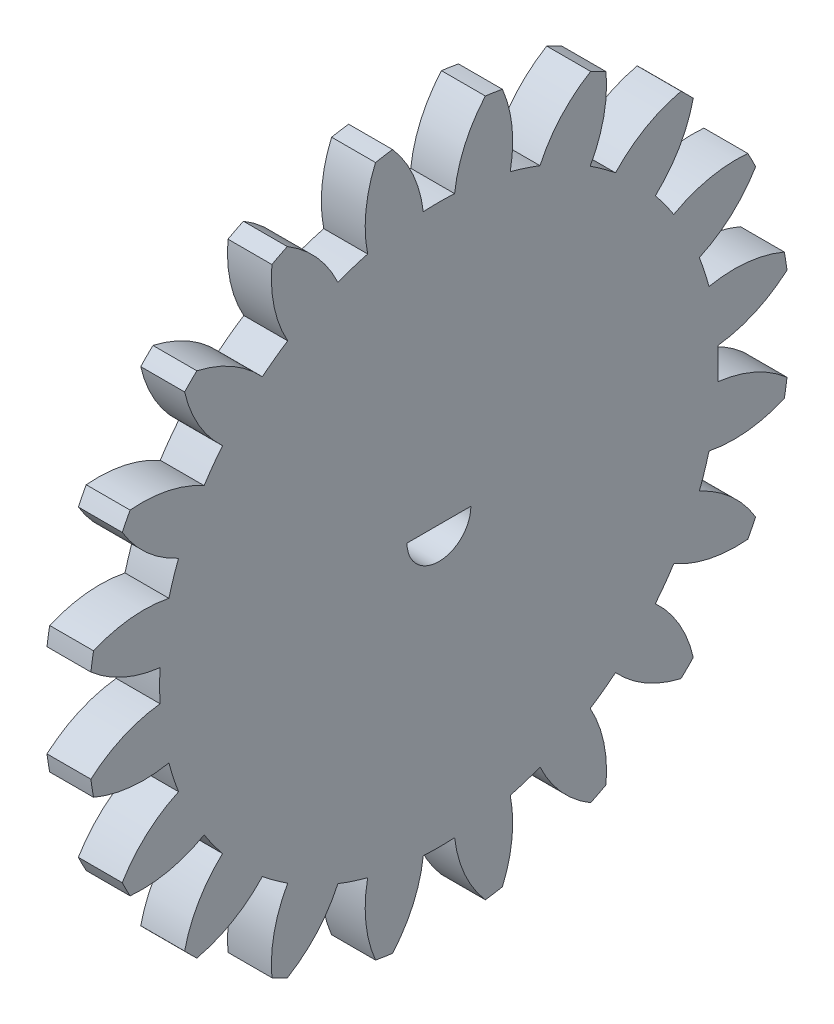
from build123d import *

# Parameters (mm, degrees)
BASPROSKE_W             = 5.5
BASPROSKE_H             = 44
TOOTHCUT_DEPTH          = 63.467991804
TEETHCUTS_COUNT         = 20
TEETHCUTS_ANGLE         = 342
BORSKE_R                = 0.5
BORE_DEPTH              = 50.0000508
CORTAR_EXTRUIR1_DEPTH   = 5.5
SALIENTE_EXTRUIR1_DEPTH = 5.5


with BuildPart() as part:
    # BasProSke → Base-Revolve (revolve)
    with BuildSketch(Plane(origin=(0, 0, 0), x_dir=(1, 0, 0), z_dir=(0, 1, 0))):
        with Locations((2.75, 22)):
            Rectangle(BASPROSKE_W, BASPROSKE_H)
    revolve(axis=Axis((-10, 0, 0), (1, 0, 0)))

    # TooCutSke → ToothCut (cut, through all)
    with BuildSketch(Plane(origin=(0, 0, 0), x_dir=(0, 0, -1), z_dir=(1, 0, 0))):
        with BuildLine():
            ThreePointArc((1.961730392, 34.943978235), (0, 34.999), (-1.961730392, 34.943978235))
            ThreePointArc((-1.961730392, 34.943978235), (-3.235659864, 39.585086827), (-5.832115241, 43.637395396))
            ThreePointArc((-5.832115241, 43.637395396), (0, 44.0254), (5.832115241, 43.637395396))
            ThreePointArc((5.832115241, 43.637395396), (3.235659864, 39.585086827), (1.961730392, 34.943978235))
        make_face()
    toothcut = extrude(amount=TOOTHCUT_DEPTH, mode=Mode.SUBTRACT)

    # TeethCuts: ToothCut ×20 about axis
    teethcuts_axis = Axis((-10, 0, 0), (1, 0, 0))
    for i in range(1, TEETHCUTS_COUNT):
        add(toothcut.rotate(teethcuts_axis, i * TEETHCUTS_ANGLE / (TEETHCUTS_COUNT - 1)), mode=Mode.SUBTRACT)

    # BorSke → Bore (cut, symmetric)
    with BuildSketch(Plane(origin=(0, 0, 0), x_dir=(0, 0, -1), z_dir=(1, 0, 0))):
        Circle(BORSKE_R)
    extrude(amount=BORE_DEPTH, both=True, mode=Mode.SUBTRACT)

    # Croquis1 → Cortar-Extruir1 (cut)
    with BuildSketch(Plane(origin=(5.5, 0, 0), x_dir=(0, 0, -1), z_dir=(1, 0, 0))):
        with BuildLine():
            Line((-4, 0), (4, 0))
            ThreePointArc((4, 0), (0, -4), (-4, 0))
        make_face()
    extrude(amount=-CORTAR_EXTRUIR1_DEPTH, mode=Mode.SUBTRACT)

    # Croquis2 → Saliente-Extruir1 (add)
    with BuildSketch(Plane(origin=(5.5, 0, 0), x_dir=(0, 0, -1), z_dir=(1, 0, 0))):
        with BuildLine():
            Line((-0.5, 0), (0.5, 0))
            ThreePointArc((0.5, 0), (0, 0.5), (-0.5, 0))
        make_face()
    extrude(amount=-SALIENTE_EXTRUIR1_DEPTH)


solid = part.part
